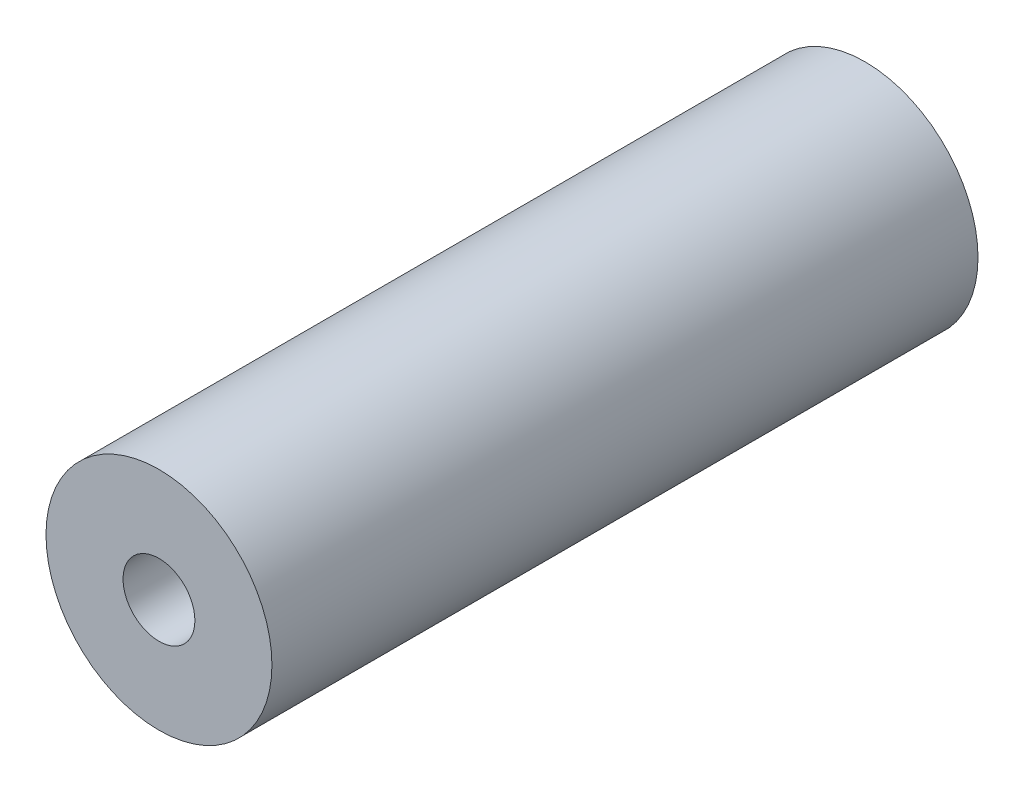
from build123d import *

# Parameters (mm, degrees)
SKETCH1_R                            = 6.35
BOSS_EXTRUDE1_DEPTH                  = 19.84375
F_10_32_TAPPED_HOLE1_D               = 4.0386
F_10_32_TAPPED_HOLE1_DEPTH           = 12.02944
F_10_32_TAPPED_HOLE1_TIP             = 1.213317848
F_10_32_TAPPED_HOLE1_ON_FACE_2_D     = 4.0386
F_10_32_TAPPED_HOLE1_ON_FACE_2_DEPTH = 12.02944
F_10_32_TAPPED_HOLE1_ON_FACE_2_TIP   = 1.213317848


with BuildPart() as part:
    # Sketch1 → Boss-Extrude1 (new, symmetric)
    with BuildSketch(Plane.XY):
        Circle(SKETCH1_R)
    extrude(amount=BOSS_EXTRUDE1_DEPTH, both=True)

    # #10-32 Tapped Hole1
    with Locations(Plane.XY.offset(19.84375)):
        with Locations((0, 0)):
            Hole(F_10_32_TAPPED_HOLE1_D / 2, depth=F_10_32_TAPPED_HOLE1_DEPTH)
            with Locations((0, 0, -(F_10_32_TAPPED_HOLE1_DEPTH + F_10_32_TAPPED_HOLE1_TIP / 2))):  # 118° drill point
                Cone(0, F_10_32_TAPPED_HOLE1_D / 2, F_10_32_TAPPED_HOLE1_TIP, mode=Mode.SUBTRACT)

    # #10-32 Tapped Hole1 on face 2
    with Locations(Plane(origin=(0, 0, -19.84375), x_dir=(-1, 0, 0), z_dir=(0, 0, -1))):
        with Locations((0, 0)):
            Hole(F_10_32_TAPPED_HOLE1_ON_FACE_2_D / 2, depth=F_10_32_TAPPED_HOLE1_ON_FACE_2_DEPTH)
            with Locations((0, 0, -(F_10_32_TAPPED_HOLE1_ON_FACE_2_DEPTH + F_10_32_TAPPED_HOLE1_ON_FACE_2_TIP / 2))):  # 118° drill point
                Cone(0, F_10_32_TAPPED_HOLE1_ON_FACE_2_D / 2, F_10_32_TAPPED_HOLE1_ON_FACE_2_TIP, mode=Mode.SUBTRACT)


solid = part.part
